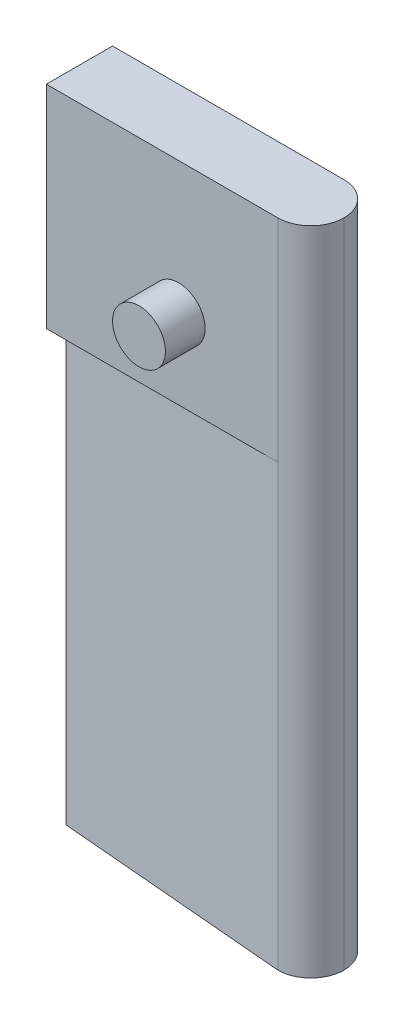
from build123d import *

# Parameters (mm, degrees)
SKETCH1_W           = 20
SKETCH1_H           = 49.25
BOSS_EXTRUDE1_DEPTH = 2.5
FILLET3_R           = 2.5
CUT_EXTRUDE1_START  = -16
CUT_EXTRUDE1_DEPTH  = 35.317119353
SKETCH14_R          = 2
BOSS_EXTRUDE2_DEPTH = 5.5


with BuildPart() as part:
    # Sketch1 → Boss-Extrude1 (new, symmetric)
    with BuildSketch(Plane.XY):
        with Locations((0, 24.625)):
            Rectangle(SKETCH1_W, SKETCH1_H)
    extrude(amount=BOSS_EXTRUDE1_DEPTH, both=True)

    # Fillet3
    fillet3_edges = [part.edges().sort_by_distance(p)[0] for p in [
        (10, 24.625, 2.5),
        (10, 24.625, -2.5),
    ]]
    fillet(fillet3_edges, radius=FILLET3_R - 0.0001)  # a hair under: the kernel refuses the full size

    # Sketch11 → Cut-Extrude1 (cut, through all)
    with BuildSketch(Plane(origin=(0, 49.25, 0), x_dir=(1, 0, 0), z_dir=(0, 1, 0)).offset(CUT_EXTRUDE1_START)):
        Polygon((-10, 1), (7.5, 2.5), (-10, 2.5), align=None)
        Polygon((7.5, -2.5), (-10, -1), (-10, -2.5), align=None)
    extrude(amount=-CUT_EXTRUDE1_DEPTH, mode=Mode.SUBTRACT)

    # Sketch14 → Boss-Extrude2 (add, symmetric)
    with BuildSketch(Plane.XY):
        with Locations((0, 39.25)):
            Circle(SKETCH14_R)
    extrude(amount=BOSS_EXTRUDE2_DEPTH, both=True)


solid = part.part
